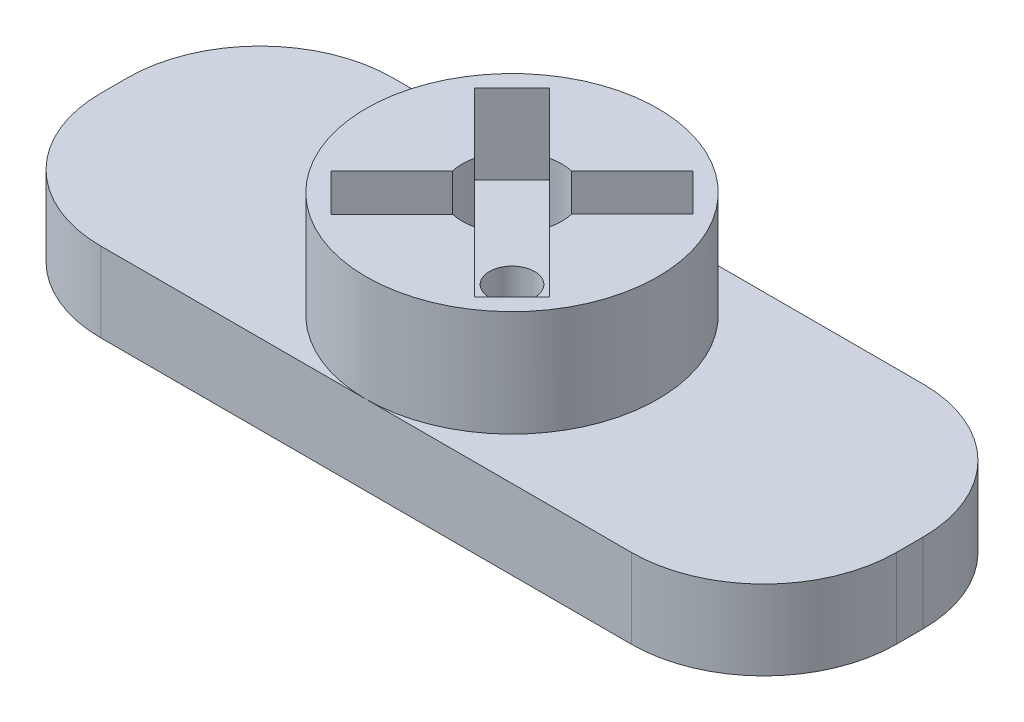
from build123d import *

# Parameters (mm, degrees)
BOSS_EXTRUDE1_DEPTH                                 = 6
SKETCH2_R                                           = 11
BOSS_EXTRUDE2_DEPTH                                 = 8
CUT_EXTRUDE1_DEPTH                                  = 6
SKETCH12_R                                          = 6
CUT_EXTRUDE2_DEPTH                                  = 4
CSK_FOR_M3_COUNTERSUNK_FLAT_HEAD_SCREW3_D           = 3.4
CSK_FOR_M3_COUNTERSUNK_FLAT_HEAD_SCREW3_CSINK_D     = 6.3
CSK_FOR_M3_COUNTERSUNK_FLAT_HEAD_SCREW3_CSINK_ANGLE = 90


with BuildPart() as part:
    # Sketch1 → Boss-Extrude1 (new body)
    with BuildSketch(Plane(origin=(0, 0, 0), x_dir=(1, 0, 0), z_dir=(0, 1, 0))):
        with BuildLine():
            Line((-20.01, -11), (20.01, -11))
            ThreePointArc((20.01, -11), (27.073996744, -8.073996744), (30, -1.01))
            Line((30, -1.01), (30, 1.01))
            ThreePointArc((30, 1.01), (27.073996744, 8.073996744), (20.01, 11))
            Line((20.01, 11), (-20.01, 11))
            ThreePointArc((-20.01, 11), (-27.073996744, 8.073996744), (-30, 1.01))
            Line((-30, 1.01), (-30, -1.01))
            ThreePointArc((-30, -1.01), (-27.073996744, -8.073996744), (-20.01, -11))
        make_face()
    extrude(amount=BOSS_EXTRUDE1_DEPTH)

    # Sketch2 → Boss-Extrude2 (add)
    with BuildSketch(Plane(origin=(0, 6, 0), x_dir=(1, 0, 0), z_dir=(0, 1, 0))):
        Circle(SKETCH2_R)
    extrude(amount=BOSS_EXTRUDE2_DEPTH)

    # Sketch5 → Cut-Extrude1 (cut)
    with BuildSketch(Plane(origin=(0, 14, 0), x_dir=(1, 0, 0), z_dir=(0, 1, 0))):
        with BuildLine():
            Line((-8.236977093, 5.410610721), (-3.657133173, 0.82938348))
            ThreePointArc((-3.657133173, 0.82938348), (-3.75, -5.4e-08), (-3.657133149, -0.829383585))
            Line((-3.657133149, -0.829383585), (-8.23655, -5.410183629))
            Line((-8.23655, -5.410183629), (-5.40855, -8.239037814))
            Line((-5.40855, -8.239037814), (-0.828279093, -3.657383456))
            ThreePointArc((-0.828279093, -3.657383456), (-5.4e-08, -3.75), (0.828278988, -3.65738348))
            Line((0.828278988, -3.65738348), (5.408122907, -8.238610721))
            Line((5.408122907, -8.238610721), (8.236977093, -5.410610721))
            Line((8.236977093, -5.410610721), (3.657133173, -0.82938348))
            ThreePointArc((3.657133173, -0.82938348), (3.75, 5.4e-08), (3.657133149, 0.829383585))
            Line((3.657133149, 0.829383585), (8.23655, 5.410183629))
            Line((8.23655, 5.410183629), (5.40855, 8.239037814))
            Line((5.40855, 8.239037814), (0.828279093, 3.657383456))
            ThreePointArc((0.828279093, 3.657383456), (5.4e-08, 3.75), (-0.828278988, 3.65738348))
            Line((-0.828278988, 3.65738348), (-5.408122907, 8.238610721))
            Line((-5.408122907, 8.238610721), (-8.236977093, 5.410610721))
        make_face()
    extrude(amount=-CUT_EXTRUDE1_DEPTH, mode=Mode.SUBTRACT)

    # Sketch12 → Cut-Extrude2 (cut)
    with BuildSketch(Plane.XZ):
        Circle(SKETCH12_R)
    extrude(amount=-CUT_EXTRUDE2_DEPTH, mode=Mode.SUBTRACT)

    # CSK for M3 Countersunk Flat Head Screw3 (through all)
    with Locations(Plane(origin=(0, 4, 0), x_dir=(-1, 0, 0), z_dir=(0, -1, 0))):
        with Locations((0, 0)):
            CounterSinkHole(CSK_FOR_M3_COUNTERSUNK_FLAT_HEAD_SCREW3_D / 2, CSK_FOR_M3_COUNTERSUNK_FLAT_HEAD_SCREW3_CSINK_D / 2, counter_sink_angle=CSK_FOR_M3_COUNTERSUNK_FLAT_HEAD_SCREW3_CSINK_ANGLE)


solid = part.part
